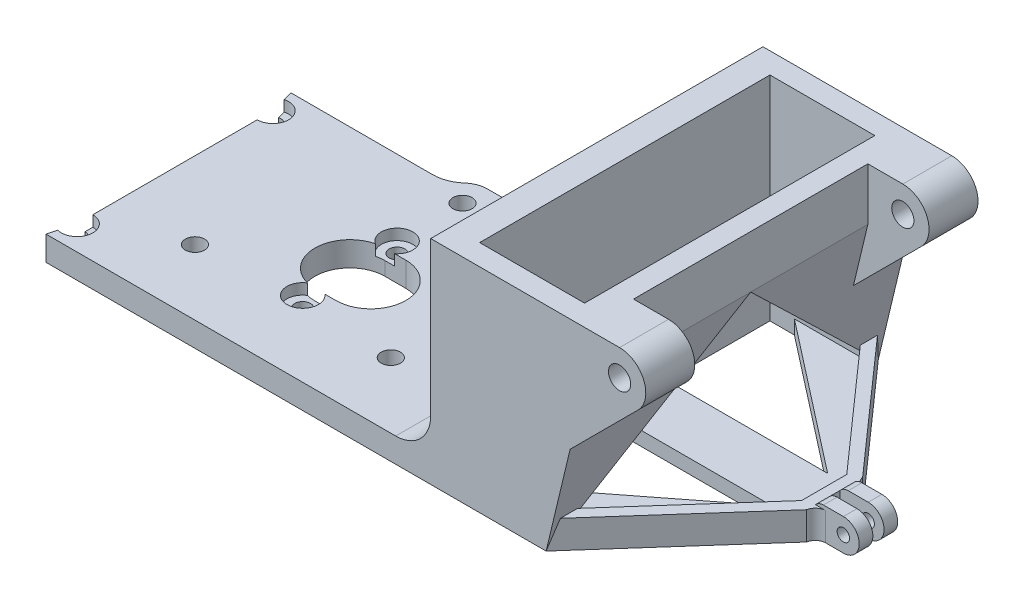
from build123d import *
from build123d.topology import SkipClean

# Parameters (mm, degrees)
SKETCH1_W                                        = 115
SKETCH1_H                                        = 95
EXTRUDE1_DEPTH                                   = 7
SKETCH2_R                                        = 2.75
SKETCH2_R_2                                      = 2.25
EXTRUDE7_DEPTH                                   = 7
CBORE_FOR_M4_PAN_HEAD_MACHINE_SCREW2_D           = 4.5
CBORE_FOR_M4_PAN_HEAD_MACHINE_SCREW2_CBORE_D     = 9
CBORE_FOR_M4_PAN_HEAD_MACHINE_SCREW2_CBORE_DEPTH = 3.1
EXTRUDE9_DEPTH                                   = 101.244700608
FILLET1_R                                        = 10
SKETCH19_W                                       = 95
SKETCH19_H                                       = 60.9
BOSS_EXTRUDE1_DEPTH                              = 8
BOSS_EXTRUDE2_DEPTH                              = 6
BOSS_EXTRUDE3_DEPTH                              = 6
SKETCH22_W                                       = 6
SKETCH22_H                                       = 15
BOSS_EXTRUDE4_DEPTH                              = 83
BOSS_EXTRUDE5_DEPTH                              = 5.834785
SKETCH25_R                                       = 3.175
BOSS_EXTRUDE6_DEPTH                              = 14
BOSS_EXTRUDE7_START                              = -14
SKETCH26_R                                       = 3.175
BOSS_EXTRUDE7_DEPTH                              = 14
FILLET2_R                                        = 10
BOSS_EXTRUDE8_DEPTH                              = 4
BOSS_EXTRUDE9_DEPTH                              = 4
BOSS_EXTRUDE10_DEPTH                             = 5.5
CUT_EXTRUDE1_DEPTH                               = 1.6
FILLET3_R                                        = 3


with BuildPart() as part:
    # Sketch1 → Extrude1 (new body)
    with BuildSketch(Plane(origin=(0, 0, 0), x_dir=(1, 0, 0), z_dir=(0, 1, 0))):
        with Locations((22.5, 12.5)):
            Rectangle(SKETCH1_W, SKETCH1_H)
    extrude(amount=EXTRUDE1_DEPTH)

    # Sketch2 → Extrude7 (cut)
    with BuildSketch(Plane(origin=(0, 0, 0), x_dir=(1, 0, 0), z_dir=(0, 1, 0))):
        with Locations(Location((-6.108955811, -16.3, 0), (0, 0, 270))):
            Circle(SKETCH2_R)
        with Locations(Location((49.891044189, -16.3, 0), (0, 0, 270))):
            Circle(SKETCH2_R)
        with Locations(Location((-28.108955811, -28, 0), (0, 0, 270))):
            Circle(SKETCH2_R_2)
        with Locations(Location((-28.108955811, 28, 0), (0, 0, 270))):
            Circle(SKETCH2_R_2)
        with Locations(Location((21.891044189, 32.2, 0), (0, 0, 270))):
            Circle(SKETCH2_R)
        with Locations(Location((21.891044189, -13.5, 0), (0, 0, 270))):
            Circle(SKETCH2_R_2)
        with Locations(Location((21.891044189, 13.5, 0), (0, 0, 270))):
            Circle(SKETCH2_R_2)
        with BuildLine():
            Line((21.891044189, 10), (27.891044189, 10))
            ThreePointArc((27.891044189, 10), (37.891044189, 0), (27.891044189, -10))
            Line((27.891044189, -10), (21.891044189, -10))
            ThreePointArc((21.891044189, -10), (11.891044189, 0), (21.891044189, 10))
        make_face()
    extrude(amount=EXTRUDE7_DEPTH, mode=Mode.SUBTRACT)

    # CBORE for M4 Pan Head Machine Screw2 (through all)
    with Locations(Plane(origin=(-28.108955811, 7, -28), x_dir=(0, 0, 1), z_dir=(0, 1, 0))):
        with Locations((0, 0), (14.5, 50), (41.5, 50), (56, 0)):
            CounterBoreHole(CBORE_FOR_M4_PAN_HEAD_MACHINE_SCREW2_D / 2, CBORE_FOR_M4_PAN_HEAD_MACHINE_SCREW2_CBORE_D / 2, CBORE_FOR_M4_PAN_HEAD_MACHINE_SCREW2_CBORE_DEPTH)

    # Sketch18 → Extrude9 (cut, through all)
    with BuildSketch(Plane(origin=(0, 7, 0), x_dir=(1, 0, 0), z_dir=(0, 1, 0))):
        with BuildLine():
            Line((21.891044189, 39.300103485), (30, 39.300103485))
            ThreePointArc((30, 39.300103485), (33.535533906, 40.764569579), (35, 44.300103485))
            Line((35, 44.300103485), (35, 60))
            Line((35, 60), (-35, 60))
            Line((-35, 60), (-35, 35))
            Line((-35, 35), (-35, -35))
            Line((-35, -35), (-30, -35))
            Line((-30, -35), (-28.108955811, -28))
            Line((-28.108955811, -28), (-28.108955811, 28))
            Line((-28.108955811, 28), (-30, 35))
            Line((-30, 35), (15.43267297, 35))
            ThreePointArc((15.43267297, 35), (18.01156456, 38.126735256), (21.891044189, 39.300103485))
        make_face()
    extrude(amount=-EXTRUDE9_DEPTH, mode=Mode.SUBTRACT)

    # Fillet1
    fillet1_edges = [part.edges().sort_by_distance(p)[0] for p in [
        (15.43267297, 3.5, -35),
        (35, 3.5, -60),
    ]]
    fillet(fillet1_edges, radius=FILLET1_R)

    # Sketch19 → Boss-Extrude1 (add)
    with BuildSketch(Plane(origin=(80, 0, 0), x_dir=(0, 0, -1), z_dir=(1, 0, 0))):
        with Locations((12.5, 30.45)):
            Rectangle(SKETCH19_W, SKETCH19_H)
    extrude(amount=BOSS_EXTRUDE1_DEPTH)

    # Sketch20 → Boss-Extrude2 (add)
    with BuildSketch(Plane(origin=(0, 0, -60), x_dir=(-1, 0, 0), z_dir=(0, 0, -1))):
        Polygon((-88, 0), (-113, 0), (-124, 45.9), (-124, 60.9), (-88, 60.9), (-80, 60.9), (-80, 7), (-45, 7), (-45, 0), align=None)
    extrude(amount=-BOSS_EXTRUDE2_DEPTH)

    # Sketch21 → Boss-Extrude3 (add)
    with BuildSketch(Plane.XY.offset(35)):
        Polygon((88, 60.9), (88, 0), (113, 0), (124, 45.9), (124, 60.9), align=None)
    extrude(amount=-BOSS_EXTRUDE3_DEPTH)

    # Sketch22 → Boss-Extrude4 (add)
    with BuildSketch(Plane.XY.offset(-54)):
        with Locations((121, 53.4)):
            Rectangle(SKETCH22_W, SKETCH22_H)
    extrude(amount=BOSS_EXTRUDE4_DEPTH)

    # Sketch23 → Boss-Extrude5 (add)
    with BuildSketch(Plane(origin=(106.862582536, -25.609769235, 0), x_dir=(0, 0, -1), z_dir=(0.9724641747215814, -0.2330524165999433, 0))):
        Polygon((12.5, 73.534605278), (54, 32.034605278), (54, 73.534605278), align=None)
        Polygon((-29, 32.034605278), (12.5, 73.534605278), (-29, 73.534605278), align=None)
    extrude(amount=-BOSS_EXTRUDE5_DEPTH)

    # Sketch25 → Boss-Extrude6 (add)
    # profile 1 of 2: a face of its own
    with BuildSketch(Plane(origin=(0, 0, -60), x_dir=(-1, 0, 0), z_dir=(0, 0, -1))):
        with BuildLine():
            Line((-124, 60.9), (-134, 60.9))
            ThreePointArc((-134, 60.9), (-141.5, 53.4), (-134, 45.9))
            Line((-134, 45.9), (-124, 45.9))
            Line((-124, 45.9), (-124, 60.9))
        make_face()
        with Locations((-134, 53.4)):
            Circle(SKETCH25_R, mode=Mode.SUBTRACT)
    # profile 2 of 2: a face of its own
    with BuildSketch(Plane(origin=(0, 0, -60), x_dir=(-1, 0, 0), z_dir=(0, 0, -1))):
        with BuildLine():
            Line((-119.868979401, 28.662377683), (-124, 45.9))
            Line((-124, 45.9), (-134, 45.9))
            ThreePointArc((-134, 45.9), (-136.870125743, 46.470903506), (-139.303300859, 48.096699141))
            Line((-139.303300859, 48.096699141), (-119.868979401, 28.662377683))
        make_face()
    extrude(amount=-BOSS_EXTRUDE6_DEPTH)

    # Sketch26 → Boss-Extrude7 (add)
    with BuildSketch(Plane.XY.offset(35).offset(BOSS_EXTRUDE7_START)):
        with BuildLine():
            Line((134, 60.9), (124, 60.9))
            Line((124, 60.9), (124, 45.9))
            Line((124, 45.9), (119.868979401, 28.662377683))
            Line((119.868979401, 28.662377683), (139.303300859, 48.096699141))
            ThreePointArc((139.303300859, 48.096699141), (140.929096494, 56.270125743), (134, 60.9))
        make_face()
        with Locations(Location((134, 53.4, 0), (0, 0, 180))):
            Circle(SKETCH26_R, mode=Mode.SUBTRACT)
    extrude(amount=BOSS_EXTRUDE7_DEPTH)

    # Fillet2
    fillet2_edges = [part.edges().sort_by_distance(p)[0] for p in [
        (80, 7, -12.5),
    ]]
    fillet(fillet2_edges, radius=FILLET2_R)

    # Sketch27 → Boss-Extrude8 (add)
    with BuildSketch(Plane.XZ):
        Polygon((95, 29), (138, -4.5), (148, -4.5), (113, 35), (113, 29), align=None)
        Polygon((138, -4.5), (88, -4.5), (88, -12.5), (148, -12.5), (148, -4.5), align=None)
        Polygon((148, -20.5), (138, -20.5), (95, -54), (113, -54), (113, -60), align=None)
        Polygon((148, -12.5), (88, -12.5), (88, -20.5), (138, -20.5), (148, -20.5), align=None)
    extrude(amount=-BOSS_EXTRUDE8_DEPTH)

    # Sketch28 → Boss-Extrude9 (add)
    with BuildSketch(Plane(origin=(0, 4, 0), x_dir=(1, 0, 0), z_dir=(0, 1, 0))):
        Polygon((148, 20.5), (113.958605664, 58.918145036), (113.958605664, 54), (145, 18.96756925), (145, 6.03243075), (113.958605664, -29), (113.958605664, -33.918145036), (148, 4.5), align=None)
    extrude(amount=BOSS_EXTRUDE9_DEPTH)

    # Sketch29 → Boss-Extrude10 (add, symmetric)
    with SkipClean():  # the faces are left unmerged after this step: merging them gives an invalid solid
        with BuildSketch(Plane.XY.offset(-12.5)):
            with BuildLine():
                ThreePointArc((160.53, 4.53), (159.203193719, 7.733193719), (156, 9.06))
                Line((156, 9.06), (156, 6.308))
                ThreePointArc((156, 6.308), (157.257235857, 5.787235857), (157.778, 4.53))
                ThreePointArc((157.778, 4.53), (157.257235857, 3.272764143), (156, 2.752))
                Line((156, 2.752), (156, 0))
                ThreePointArc((156, 0), (159.203193719, 1.326806281), (160.53, 4.53))
            make_face()
            with BuildLine():
                Line((156, 6.308), (156, 9.06))
                ThreePointArc((156, 9.06), (151.47, 4.53), (156, 0))
                Line((156, 0), (156, 2.752))
                ThreePointArc((156, 2.752), (154.222, 4.53), (156, 6.308))
            make_face()
            with BuildLine():
                Line((156, 9.06), (148, 9.06))
                Line((148, 9.06), (148, 0))
                Line((148, 0), (156, 0))
                ThreePointArc((156, 0), (151.47, 4.53), (156, 9.06))
            make_face()
        extrude(amount=BOSS_EXTRUDE10_DEPTH, both=True)

    # Sketch29<3> → Cut-Extrude1 (cut, symmetric)
    with BuildSketch(Plane.XY.offset(-12.5)):
        with BuildLine():
            Line((156, 9.06), (148, 9.06))
            Line((148, 9.06), (148, 0))
            Line((148, 0), (156, 0))
            ThreePointArc((156, 0), (151.47, 4.53), (156, 9.06))
        make_face()
        with BuildLine():
            ThreePointArc((160.53, 4.53), (159.203193719, 7.733193719), (156, 9.06))
            Line((156, 9.06), (156, 6.308))
            ThreePointArc((156, 6.308), (157.257235857, 5.787235857), (157.778, 4.53))
            ThreePointArc((157.778, 4.53), (157.257235857, 3.272764143), (156, 2.752))
            Line((156, 2.752), (156, 0))
            ThreePointArc((156, 0), (159.203193719, 1.326806281), (160.53, 4.53))
        make_face()
        with BuildLine():
            Line((156, 6.308), (156, 9.06))
            ThreePointArc((156, 9.06), (151.47, 4.53), (156, 0))
            Line((156, 0), (156, 2.752))
            ThreePointArc((156, 2.752), (154.222, 4.53), (156, 6.308))
        make_face()
    extrude(amount=CUT_EXTRUDE1_DEPTH, both=True, mode=Mode.SUBTRACT)

    # Fillet3
    # the kernel refuses this fillet: 3 mm, written as the material it adds along each edge
    with BuildSketch(Plane(origin=(148, 8, -18), x_dir=(0, 0, -1), z_dir=(0, -1, 0))) as fillet3_piece_1:
        with BuildLine():
            CenterArc((3, 2.958039892), FILLET3_R, 180, 80.405931773)
            Line((0, 2.958039892), (0, 0))
            Line((0, 0), (2.5, 0))
        make_face()
    extrude(amount=8)
    with BuildSketch(Plane(origin=(148, 8, -7), x_dir=(1, 0, 0), z_dir=(0, -1, 0))) as fillet3_piece_2:
        with BuildLine():
            CenterArc((2.958039892, 3), FILLET3_R, 189.594068227, 80.405931773)
            Line((0, 2.5), (0, 0))
            Line((0, 0), (2.958039892, 0))
        make_face()
    extrude(amount=8)
    # the kernel refuses this fillet: 3 mm, written as the material it takes off along each edge
    with BuildSketch(Plane(origin=(148, 9.06, -16.620795399), x_dir=(0, -1, 0), z_dir=(0, 0, 1))) as fillet3_2_piece_1:
        with BuildLine():
            CenterArc((3, 2.28831816), FILLET3_R, 180, 49.709248271)
            Line((0, 2.28831816), (0, 0))
            Line((0, 0), (1.06, 0))
        make_face()
    extrude(amount=15.341590798, mode=Mode.SUBTRACT)
    with BuildSketch(Plane(origin=(148, 9.06, -23.720795399), x_dir=(1, 0, 0), z_dir=(0, 0, 1))) as fillet3_2_piece_2:
        with BuildLine():
            CenterArc((2.28831816, -3), FILLET3_R, 90, 49.709248271)
            Line((0, -1.06), (0, 0))
            Line((0, 0), (2.28831816, 0))
        make_face()
    extrude(amount=15.341590798, mode=Mode.SUBTRACT)


solid = part.part
